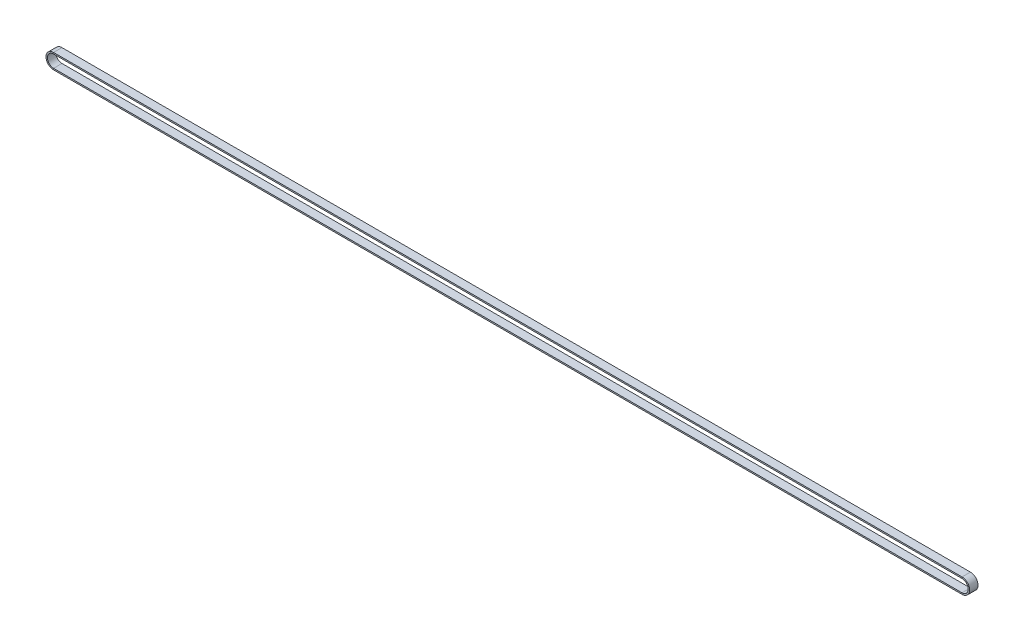
from build123d import *

# Parameters (mm, degrees)
SKETCH3_W = 9
SKETCH3_H = 1.5


with BuildPart() as part:
    # Sweep1: sweep along a path in Sketch2
    with BuildLine(Plane.XY) as sweep1_path:
        Line((-0.000133637, 41.109015103), (-976.331033952, 41.109015103))
        ThreePointArc((-976.331033952, 41.109015103), (-984.470783952, 49.248765103), (-976.331033952, 57.388515103))
        Line((-976.331033952, 57.388515103), (-0.000133637, 57.388515103))
        ThreePointArc((-0.000133637, 57.388515103), (8.139616363, 49.248765103), (-0.000133637, 41.109015103))
    # Sketch3 → Sweep1 (sweep)
    with BuildSketch(Plane(origin=(-0.000133637, 57.388515103, 0), x_dir=(0, 0, -1), z_dir=(1, 0, 0))):
        with Locations((4.5, -0.75)):
            Rectangle(SKETCH3_W, SKETCH3_H)
    sweep(path=sweep1_path.line)


solid = part.part
